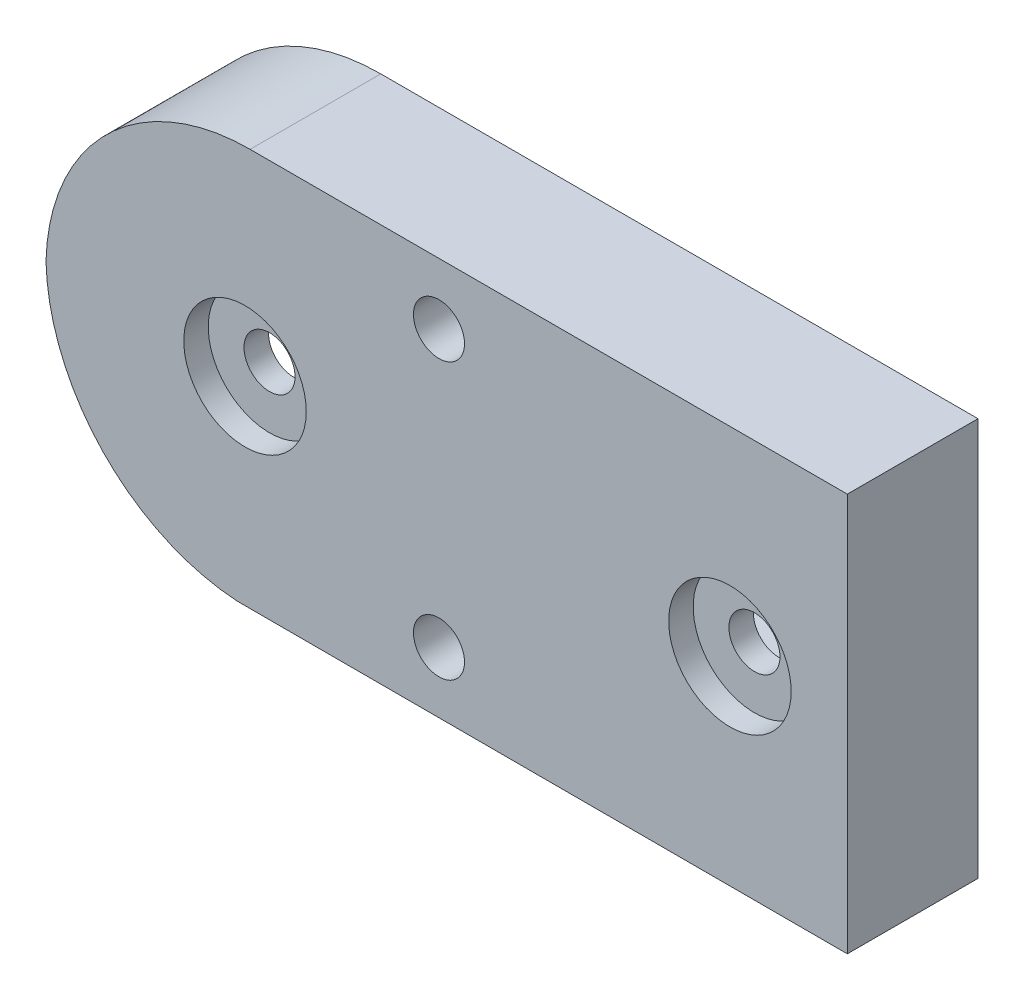
from build123d import *

# Parameters (mm, degrees)
SKETCH1_R           = 1.25
BOSS_EXTRUDE4_DEPTH = 4
FILLET1_R           = 10
SKETCH2_R           = 1.25
BOSS_EXTRUDE5_DEPTH = 1.2
SKETCH3_R           = 3
SKETCH3_R_2         = 1.25
BOSS_EXTRUDE6_DEPTH = 1.2


with BuildPart() as part:
    # Sketch1 → Boss-Extrude4 (new body)
    with BuildSketch(Plane.XY):
        Polygon((-9.75, 9.75), (-9.75, 0), (-9.75, -9.75), (29.5, -9.75), (29.5, -6.75), (29.5, 6.75), (29.5, 9.75), align=None)
        with Locations((9.5, -6.75)):
            Circle(SKETCH1_R, mode=Mode.SUBTRACT)
        with Locations((9.5, 6.75)):
            Circle(SKETCH1_R, mode=Mode.SUBTRACT)
        with BuildLine():
            ThreePointArc((4.901044183, -6.003521127), (-3.322604971, -7.001628111), (-7.75, 0))
            ThreePointArc((-7.75, 0), (-3.322604971, 7.001628111), (4.901044183, 6.003521127))
            ThreePointArc((4.901044183, 6.003521127), (7.868246727, 4.330212616), (11.22497216, 3.75))
            Line((11.22497216, 3.75), (23.75, 3.75))
            ThreePointArc((23.75, 3.75), (26.401650429, 2.651650429), (27.5, 0))
            ThreePointArc((27.5, 0), (26.401650429, -2.651650429), (23.75, -3.75))
            Line((23.75, -3.75), (11.22497216, -3.75))
            ThreePointArc((11.22497216, -3.75), (7.868246727, -4.330212616), (4.901044183, -6.003521127))
        make_face(mode=Mode.SUBTRACT)
    extrude(amount=BOSS_EXTRUDE4_DEPTH)

    # Fillet1
    # the kernel refuses this fillet: 10 mm, written as the material it takes off along each edge
    with BuildSketch(Plane(origin=(-9.75, -9.75, -25), x_dir=(0, 1, 0), z_dir=(0, 0, 1))) as fillet1_piece_1:
        with BuildLine():
            CenterArc((FILLET1_R, -FILLET1_R), FILLET1_R, 90, 90)
            Line((0, -FILLET1_R), (0, 0))
            Line((0, 0), (FILLET1_R, 0))
        make_face()
    extrude(amount=54, mode=Mode.SUBTRACT)
    with BuildSketch(Plane(origin=(-9.75, 9.75, -25), x_dir=(0, -1, 0), z_dir=(0, 0, 1))) as fillet1_piece_2:
        with BuildLine():
            CenterArc((FILLET1_R, FILLET1_R), FILLET1_R, 180, 90)
            Line((0, FILLET1_R), (0, 0))
            Line((0, 0), (FILLET1_R, 0))
        make_face()
    extrude(amount=54, mode=Mode.SUBTRACT)

    # Sketch2 → Boss-Extrude5 (add)
    # profile 1 of 4: a face of its own
    with BuildSketch(Plane.XY.offset(4)):
        with BuildLine():
            ThreePointArc((8.882472313, 4.028236041), (5.388428188, 8.129565896), (0.25, 9.75))
            ThreePointArc((0.25, 9.75), (-6.732120022, 6.908910532), (-9.746874512, 0))
            ThreePointArc((-9.746874512, 0), (-6.957195545, -6.682267477), (-0.388423062, -9.729599992))
            Line((-0.388423062, -9.729599992), (0.667724562, -9.730320853))
            ThreePointArc((0.667724562, -9.730320853), (5.561475334, -8.012177738), (8.882472313, -4.028236041))
            ThreePointArc((8.882472313, -4.028236041), (6.780629621, -4.791885277), (4.901044183, -6.003521127))
            ThreePointArc((4.901044183, -6.003521127), (-7.75, 0), (4.901044183, 6.003521127))
            ThreePointArc((4.901044183, 6.003521127), (6.780629621, 4.791885277), (8.882472313, 4.028236041))
        make_face()
    # profile 2 of 4: a face of its own
    with BuildSketch(Plane.XY.offset(4)):
        with BuildLine():
            ThreePointArc((9.753204602, 0), (9.5330365, 2.060634631), (8.882472313, 4.028236041))
            ThreePointArc((8.882472313, 4.028236041), (6.780629621, 4.791885277), (4.901044183, 6.003521127))
            ThreePointArc((4.901044183, 6.003521127), (-7.75, 0), (4.901044183, -6.003521127))
            ThreePointArc((4.901044183, -6.003521127), (6.780629621, -4.791885277), (8.882472313, -4.028236041))
            ThreePointArc((8.882472313, -4.028236041), (9.5330365, -2.060634631), (9.753204602, 0))
        make_face()
        Circle(SKETCH2_R, mode=Mode.SUBTRACT)
    # profile 3 of 4: a face of its own
    with BuildSketch(Plane.XY.offset(4)):
        with BuildLine():
            Line((29.5, -9.75), (29.5, 9.75))
            Line((29.5, 9.75), (0.25, 9.75))
            ThreePointArc((0.25, 9.75), (5.388428188, 8.129565896), (8.882472313, 4.028236041))
            ThreePointArc((8.882472313, 4.028236041), (10.045489135, 3.819802631), (11.22497216, 3.75))
            Line((11.22497216, 3.75), (23.75, 3.75))
            ThreePointArc((23.75, 3.75), (27.5, 0), (23.75, -3.75))
            Line((23.75, -3.75), (11.22497216, -3.75))
            ThreePointArc((11.22497216, -3.75), (10.045489135, -3.819802631), (8.882472313, -4.028236041))
            ThreePointArc((8.882472313, -4.028236041), (5.561475334, -8.012177738), (0.667724562, -9.730320853))
            Line((0.667724562, -9.730320853), (29.5, -9.75))
        make_face()
        with Locations((9.5, -6.75)):
            Circle(SKETCH2_R, mode=Mode.SUBTRACT)
        with Locations((9.5, 6.75)):
            Circle(SKETCH2_R, mode=Mode.SUBTRACT)
    # profile 4 of 4: a face of its own
    with BuildSketch(Plane.XY.offset(4)):
        with BuildLine():
            ThreePointArc((11.22497216, 3.75), (10.045489135, 3.819802631), (8.882472313, 4.028236041))
            ThreePointArc((8.882472313, 4.028236041), (9.5330365, 2.060634631), (9.753204602, 0))
            ThreePointArc((9.753204602, 0), (9.5330365, -2.060634631), (8.882472313, -4.028236041))
            ThreePointArc((8.882472313, -4.028236041), (10.045489135, -3.819802631), (11.22497216, -3.75))
            Line((11.22497216, -3.75), (23.75, -3.75))
            ThreePointArc((23.75, -3.75), (27.5, 0), (23.75, 3.75))
            Line((23.75, 3.75), (11.22497216, 3.75))
        make_face()
        with Locations((23.75, 0)):
            Circle(SKETCH2_R, mode=Mode.SUBTRACT)
    extrude(amount=BOSS_EXTRUDE5_DEPTH)

    # Sketch3 → Boss-Extrude6 (add)
    # profile 1 of 2: a face of its own
    with BuildSketch(Plane.XY.offset(5.2)):
        with BuildLine():
            ThreePointArc((9.75, 0), (6.938066581, 6.850235917), (0.124208797, 9.749208797))
            ThreePointArc((0.124208797, 9.749208797), (-6.777009203, 6.864853594), (-9.746874512, 0))
            ThreePointArc((-9.746874512, 0), (-6.957195545, -6.682267477), (-0.388423062, -9.729599992))
            Line((-0.388423062, -9.729599992), (0.619672772, -9.730288056))
            ThreePointArc((0.619672772, -9.730288056), (7.110003851, -6.671607395), (9.75, 0))
        make_face()
        Circle(SKETCH3_R, mode=Mode.SUBTRACT)
    # profile 2 of 2: a face of its own
    with BuildSketch(Plane.XY.offset(5.2)):
        with BuildLine():
            Line((29.5, 9.75), (0.25, 9.75))
            ThreePointArc((0.25, 9.75), (0.187103155, 9.749802197), (0.124208797, 9.749208797))
            ThreePointArc((0.124208797, 9.749208797), (6.938066581, 6.850235917), (9.75, 0))
            ThreePointArc((9.75, 0), (7.110003851, -6.671607395), (0.619672772, -9.730288056))
            Line((0.619672772, -9.730288056), (29.5, -9.75))
            Line((29.5, -9.75), (29.5, 9.75))
        make_face()
        with Locations((9.5, -6.75)):
            Circle(SKETCH3_R_2, mode=Mode.SUBTRACT)
        with Locations((9.5, 6.75)):
            Circle(SKETCH3_R_2, mode=Mode.SUBTRACT)
        with Locations((23.75, 0)):
            Circle(SKETCH3_R, mode=Mode.SUBTRACT)
    extrude(amount=BOSS_EXTRUDE6_DEPTH)


solid = part.part
